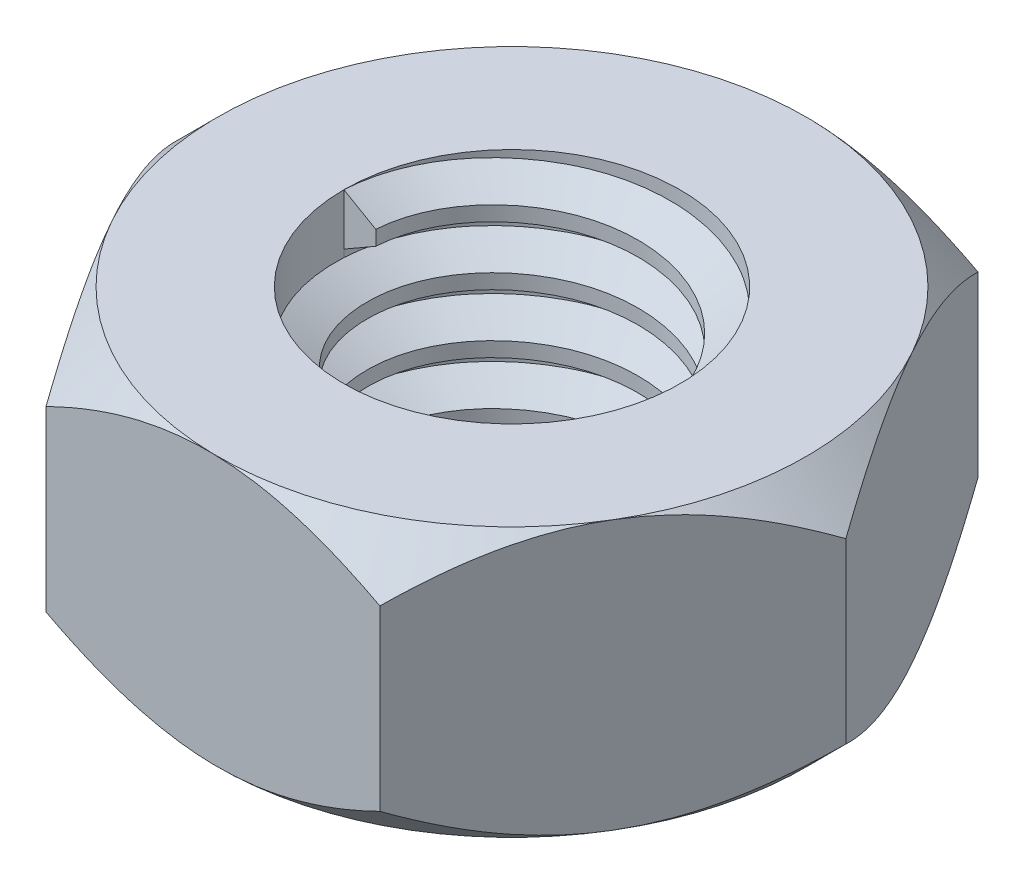
from build123d import *

# Parameters (mm, degrees)
SKETCH1_R               = 2
BOSS_EXTRUDE1_DEPTH     = 3.2
SKETCH2_OUTSIDE_W       = 18.722
SKETCH2_OUTSIDE_H       = 17.706
SKETCH2_OUTSIDE_R       = 3.5
CUT_EXTRUDE1_DEPTH      = 3.2
CUT_EXTRUDE1_DRAFT      = -45
MIRROR1_COPY_1_SKETCH_W = 18.722
MIRROR1_COPY_1_SKETCH_H = 17.706
MIRROR1_COPY_1_SKETCH_R = 3.5
MIRROR1_COPY_1_DEPTH    = 3.2
MIRROR1_COPY_1_DRAFT    = -45
THREAD1_PITCH           = 0.7


with BuildPart() as part:
    # Sketch1 → Boss-Extrude1 (new body)
    with BuildSketch(Plane(origin=(0, 0, 0), x_dir=(1, 0, 0), z_dir=(0, 1, 0))):
        Polygon((2.07930984, 3.4655164), (-1.96157032, 3.533493344), (-4.04088016, 0.067976944), (-2.07930984, -3.4655164), (1.96157032, -3.533493344), (4.04088016, -0.067976944), align=None)
        with Locations(Location((0, 0, 0), (0, 0, 270))):
            Circle(SKETCH1_R, mode=Mode.SUBTRACT)
    extrude(amount=BOSS_EXTRUDE1_DEPTH)


with BuildPart() as cut_extrude1_tool:
    # Sketch2 outside → Cut-Extrude1 (with draft: the straight prism first)
    with BuildSketch(Plane(origin=(0, 3.2, 0), x_dir=(1, 0, 0), z_dir=(0, 1, 0))):
        Rectangle(SKETCH2_OUTSIDE_W, SKETCH2_OUTSIDE_H)
        Circle(SKETCH2_OUTSIDE_R, mode=Mode.SUBTRACT)
    extrude(amount=-CUT_EXTRUDE1_DEPTH)
    # Cut-Extrude1: the draft: its side faces are tilted about the plane it starts from
    cut_extrude1_sides = [cut_extrude1_tool.faces().sort_by_distance(p)[0] for p in [
        (0, 1.6, 8.853),
        (9.361, 1.6, 0),
        (0, 1.6, -8.853),
        (-9.361, 1.6, 0),
        (-3.5, 1.6, 0),
    ]]
    draft(cut_extrude1_sides, Plane(origin=(0, 3.2, 0), x_dir=(1, 0, 0), z_dir=(0, 1, 0)), CUT_EXTRUDE1_DRAFT)


with BuildPart() as part_1:
    add(part.part)

    # Cut-Extrude1: cut by cut_extrude1_tool
    add(cut_extrude1_tool.part, mode=Mode.SUBTRACT)


with BuildPart() as mirror1_copy_1_tool:
    # Mirror1 copy 1 sketch → Mirror1 copy 1 (with draft: the straight prism first)
    with BuildSketch(Plane.XZ):
        Rectangle(MIRROR1_COPY_1_SKETCH_W, MIRROR1_COPY_1_SKETCH_H)
        Circle(MIRROR1_COPY_1_SKETCH_R, mode=Mode.SUBTRACT)
    extrude(amount=-MIRROR1_COPY_1_DEPTH)
    # Mirror1 copy 1: the draft: its side faces are tilted about the plane it starts from
    mirror1_copy_1_sides = [mirror1_copy_1_tool.faces().sort_by_distance(p)[0] for p in [
        (0, 1.6, 8.853),
        (9.361, 1.6, 0),
        (0, 1.6, -8.853),
        (-9.361, 1.6, 0),
        (-3.5, 1.6, 0),
    ]]
    draft(mirror1_copy_1_sides, Plane.XZ, MIRROR1_COPY_1_DRAFT)


with BuildPart() as part_2:
    add(part_1.part)

    # Mirror1 copy 1: cut by mirror1_copy_1_tool
    add(mirror1_copy_1_tool.part, mode=Mode.SUBTRACT)

    # Thread1: the profile of Thread Profile1 profile screwed along a right-hand helix of 3.571429 turns, 6 arcs to a turn; built about Z, then put on its axis
    thread1_z = Axis((0, 0, 0), (0, 0, 1))
    thread1_corners = [(2.0003, 0, -0.000173205), (2.0003, 0, 0.612673203), (1.621113887, 0, 0.393749999), (1.621113887, 0, 0.218749999)]
    with BuildLine(mode=Mode.PRIVATE) as thread1_profile:
        Line(thread1_corners[0], thread1_corners[1])
        Line(thread1_corners[1], thread1_corners[2])
        Line(thread1_corners[2], thread1_corners[3])
        Line(thread1_corners[3], thread1_corners[0])
    thread1_cap = Face(thread1_profile.wire())
    thread1_turn_angles = [0, 30, 60, 90, 120, 150, 180, 210, 240, 270, 300, 330, 360]
    thread1_turn_weights = [1, 0.8660254037844387, 1, 0.8660254037844387, 1, 0.8660254037844387, 1, 0.8660254037844387, 1, 0.8660254037844387, 1, 0.8660254037844387, 1]
    thread1_turn_rails = [Edge.make_bspline([Vector(p[0], p[1], 0).rotate(thread1_z, thread1_turn_angles[k]) / thread1_turn_weights[k] + Vector(0, 0, p[2] + THREAD1_PITCH * thread1_turn_angles[k] / 360) for k in range(13)], [0, 0, 0, 1, 1, 2, 2, 3, 3, 4, 4, 5, 5, 6, 6, 6], 2, thread1_turn_weights) for p in thread1_corners]
    thread1_turn_sides = [Face.make_surface_from_curves(thread1_turn_rails[p[0]], thread1_turn_rails[p[1]]) for p in [(0, 1), (1, 2), (2, 3), (3, 0)]]
    thread1_last_angles = [1080, 1110, 1140, 1170, 1200, 1230, 1260, 1272.857142857, 1285.714285714]
    thread1_last_weights = [1, 0.8660254037844387, 1, 0.8660254037844387, 1, 0.8660254037844387, 1, 0.9749279121818235, 1]
    thread1_last_rails = [Edge.make_bspline([Vector(p[0], p[1], 0).rotate(thread1_z, thread1_last_angles[k]) / thread1_last_weights[k] + Vector(0, 0, p[2] + THREAD1_PITCH * thread1_last_angles[k] / 360) for k in range(9)], [0, 0, 0, 1, 1, 2, 2, 3, 3, 4, 4, 4], 2, thread1_last_weights) for p in thread1_corners]
    thread1_last_sides = [Face.make_surface_from_curves(thread1_last_rails[p[0]], thread1_last_rails[p[1]]) for p in [(0, 1), (1, 2), (2, 3), (3, 0)]]
    thread1 = Plane(origin=(0, 3.2, 0), x_dir=(-1, 0, 0), z_dir=(0, -1, 0)) * Solid(Shell([*[p.moved(Location((0, 0, THREAD1_PITCH * i))) for i in range(3) for p in thread1_turn_sides], *thread1_last_sides, thread1_cap, thread1_cap.rotate(thread1_z, 1285.714285714).moved(Location((0, 0, THREAD1_PITCH * 1285.714285714 / 360)))]))
    add(thread1)


solid = part_2.part
